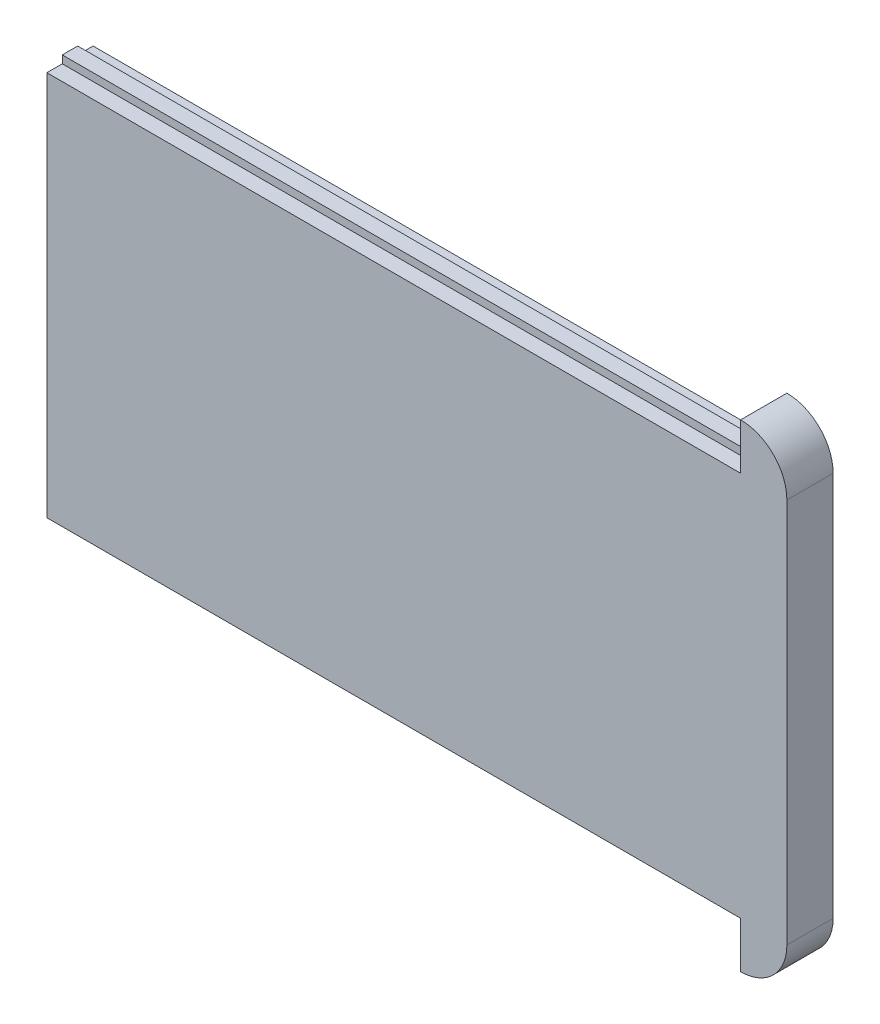
from build123d import *

# Parameters (mm, degrees)
SKETCH1_W           = 45
SKETCH1_H           = 25
BOSS_EXTRUDE1_DEPTH = 3
SKETCH2_W           = 3
SKETCH2_H           = 3
BOSS_EXTRUDE2_DEPTH = 3
SKETCH3_W           = 1
SKETCH3_H           = 0.5
BOSS_EXTRUDE3_DEPTH = 45
SKETCH4_W           = 3
SKETCH4_H           = 25
BOSS_EXTRUDE4_DEPTH = 3
FILLET1_R           = 3


with BuildPart() as part:
    # Sketch1 → Boss-Extrude1 (new body)
    with BuildSketch(Plane.XY):
        Rectangle(SKETCH1_W, SKETCH1_H)
    extrude(amount=BOSS_EXTRUDE1_DEPTH)

    # Sketch2 → Boss-Extrude2 (add)
    with BuildSketch(Plane(origin=(22.5, 0, 0), x_dir=(0, 0, -1), z_dir=(1, 0, 0))):
        with Locations((-1.5, -14)):
            Rectangle(SKETCH2_W, SKETCH2_H)
        with Locations((-1.5, 14)):
            Rectangle(SKETCH2_W, SKETCH2_H)
    extrude(amount=-BOSS_EXTRUDE2_DEPTH)

    # Sketch3 → Boss-Extrude3 (add)
    with BuildSketch(Plane.ZY.offset(-19.5)):
        with Locations((1.5, -12.75)):
            Rectangle(SKETCH3_W, SKETCH3_H)
        with Locations((1.5, 12.75)):
            Rectangle(SKETCH3_W, SKETCH3_H)
    extrude(amount=BOSS_EXTRUDE3_DEPTH)

    # Sketch4 → Boss-Extrude4 (add)
    with BuildSketch(Plane.ZY.offset(22.5)):
        with Locations((1.5, 0)):
            Rectangle(SKETCH4_W, SKETCH4_H)
    extrude(amount=BOSS_EXTRUDE4_DEPTH)

    # Fillet1
    fillet1_edges = [part.edges().sort_by_distance(p)[0] for p in [
        (22.5, 15.5, 1.5),
        (22.5, -15.5, 1.5),
    ]]
    fillet(fillet1_edges, radius=FILLET1_R - 0.0001)  # a hair under: the kernel refuses the full size


solid = part.part
